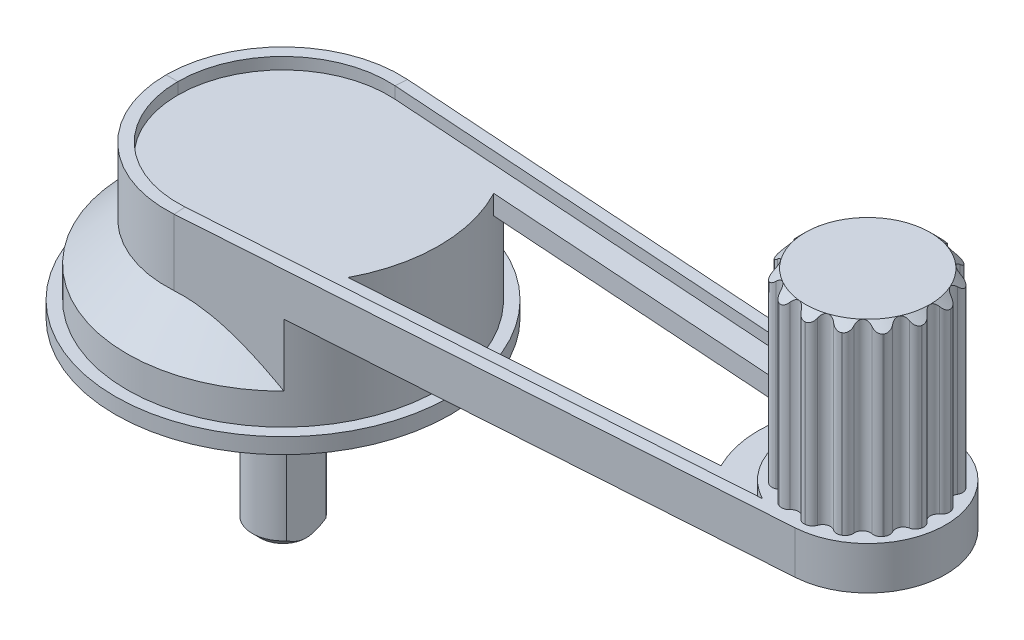
from build123d import *

# Parameters (mm, degrees)
EXTRUDE_START                    = -5
EXTRUDE_1_DEPTH                  = 12
SKETCH_5_R                       = 10
EXTRUDE_2_DEPTH                  = 5.5
EXTRUDE_3_DEPTH                  = 2.5
SKETCH_7_R                       = 9
EXTRUDE_4_DEPTH                  = 23.5
CHAMFER_1_SIZE                   = 1
SKETCH_8_R                       = 1
CUT_EXTRUDE_1_DEPTH              = 23.5
FILLET_1_R                       = 1
PATTERN_CIRCULAR_1_COUNT         = 15
FILLET_1_OF_PATTERN_CIRCULAR_1_R = 1
SKETCH_9_W                       = 3.915535099
SKETCH_9_H                       = 16.198515065
CUT_EXTRUDE_2_DEPTH              = 20


with BuildPart() as part:
    # 草图1 → 旋转1 (revolve)
    with BuildSketch(Plane.XY, mode=Mode.PRIVATE) as revolve_1_sk:
        Polygon((0, 0), (-3.925, 0), (-3.925, 20), (-11.5, 20), (-11.5, 23), (-21.5, 23), (-21.5, 25), (-20, 25), (-20, 29), (-15, 34), (0, 34), align=None)
    revolve(revolve_1_sk.sketch.rotate(Axis((0, 0, 0), (0, -1, 0)), 270), axis=Axis((0, 0, 0), (0, -1, 0)))



with BuildPart() as body_2:
    # 扫描1: sweep along a path in 草图3
    with BuildLine(Plane(origin=(0, 42.5, 0), x_dir=(1, 0, 0), z_dir=(0, 1, 0))) as sweep_1_path:
        Line((1, 14.966629547), (75.666666667, 9.977753031))
        ThreePointArc((75.666666667, 9.977753031), (85, 0), (75.666666667, -9.977753031))
        Line((75.666666667, -9.977753031), (1, -14.966629547))
        ThreePointArc((1, -14.966629547), (-15, 0), (1, 14.966629547))
    # 草图2 → 扫描1 (sweep)
    with BuildSketch(Plane.XY):
        Polygon((-15, 42.5), (-15, 37), (-13.5, 37), (-13.5, 38.5), (-10.5, 38.5), (-10.5, 41), (-13.5, 41), (-13.5, 42.5), align=None)
    sweep(path=sweep_1_path.line)


with BuildPart() as part_1:
    add(part.part)

    add(body_2.part)  # 凸台-拉伸1 merges body 2
    # 草图4 → 凸台-拉伸1 (add)
    with BuildSketch(Plane(origin=(0, 34, 0), x_dir=(1, 0, 0), z_dir=(0, 1, 0)).offset(EXTRUDE_START)):
        with BuildLine():
            Line((14.199326582, -14.084712443), (1, -14.966629547))
            ThreePointArc((1, -14.966629547), (-10.246950766, -10.95445115), (-15, 0))
            ThreePointArc((-15, 0), (-10.246950766, 10.95445115), (1, 14.966629547))
            Line((1, 14.966629547), (14.199326582, 14.084712443))
            ThreePointArc((14.199326582, 14.084712443), (20, 0), (14.199326582, -14.084712443))
        make_face()
    extrude(amount=EXTRUDE_1_DEPTH)

    # 草图5 → 凸台-拉伸2 (add)
    with BuildSketch(Plane.XZ.offset(-37)):
        with Locations((75, 0)):
            Circle(SKETCH_5_R)
    extrude(amount=-EXTRUDE_2_DEPTH)

    # 草图6 → 凸台-拉伸3 (add)
    with BuildSketch(Plane.XZ.offset(-38.5)):
        with BuildLine():
            Line((65.890505184, -10.630950296), (75.666666667, -9.977753031))
            ThreePointArc((75.666666667, -9.977753031), (65, 0), (75.666666667, 9.977753031))
            Line((75.666666667, 9.977753031), (65.890505184, 10.630950296))
            ThreePointArc((65.890505184, 10.630950296), (61, 0), (65.890505184, -10.630950296))
        make_face()
    extrude(amount=-EXTRUDE_3_DEPTH)

    # 草图7 → 凸台-拉伸4 (add)
    with BuildSketch(Plane(origin=(0, 42.5, 0), x_dir=(1, 0, 0), z_dir=(0, 1, 0))):
        with Locations(Location((75, 0, 0), (0, 0, 90))):
            Circle(SKETCH_7_R)
    extrude(amount=EXTRUDE_4_DEPTH)

    # 倒角1
    chamfer_1_edges = [part_1.edges().sort_by_distance(p)[0] for p in [
        (75, 66, 9),
    ]]
    chamfer(chamfer_1_edges, length=CHAMFER_1_SIZE)

    # 草图8 → 切除-拉伸1 (cut)
    with BuildSketch(Plane(origin=(0, 66, 0), x_dir=(1, 0, 0), z_dir=(0, 1, 0))):
        with Locations((84, 0)):
            Circle(SKETCH_8_R)
    cut_extrude_1 = extrude(amount=-CUT_EXTRUDE_1_DEPTH, mode=Mode.SUBTRACT)

    # 圆角1
    fillet_1_edges = [part_1.edges().sort_by_distance(p)[0] for p in [
        (83.944444444, 53.75, 0.998455598),
        (83.944444444, 53.75, -0.998455598),
    ]]
    fillet(fillet_1_edges, radius=FILLET_1_R)

    # 阵列(圆周)1: 切除-拉伸1 ×15 about axis
    pattern_circular_1_axis = Axis((75, 0, 0), (0, 1, 0))
    for i in range(1, PATTERN_CIRCULAR_1_COUNT):
        add(cut_extrude_1.rotate(pattern_circular_1_axis, i * 360 / PATTERN_CIRCULAR_1_COUNT), mode=Mode.SUBTRACT)

    # 圆角1 of 阵列(圆周)1
    fillet_1_of_pattern_circular_1_edges = [part_1.edges().sort_by_distance(p)[0] for p in [
        (83.577265071, 53.75, -2.725898732),
        (82.765048115, 53.75, -4.550167883),
        (81.726998645, 53.75, -5.978920406),
        (80.243004424, 53.75, -7.315114805),
        (78.713573041, 53.75, -8.198132426),
        (76.814397636, 53.75, -8.815211921),
        (75.058036921, 53.75, -8.999812871),
        (73.072065014, 53.75, -8.791078813),
        (71.39246569, 53.75, -8.24534391),
        (69.663089866, 53.75, -7.246888313),
        (68.350669915, 53.75, -6.065180081),
        (67.176914964, 53.75, -4.449644988),
        (66.458603718, 53.75, -2.836291515),
        (66.043422535, 53.75, -0.883017621),
        (66.043422535, 53.75, 0.883017621),
        (66.458603718, 53.75, 2.836291515),
        (67.176914964, 53.75, 4.449644988),
        (68.350669915, 53.75, 6.065180081),
        (69.663089866, 53.75, 7.246888313),
        (71.39246569, 53.75, 8.24534391),
        (73.072065014, 53.75, 8.791078813),
        (75.058036921, 53.75, 8.999812871),
        (76.814397636, 53.75, 8.815211921),
        (78.713573041, 53.75, 8.198132426),
        (80.243004424, 53.75, 7.315114805),
        (81.726998645, 53.75, 5.978920406),
        (82.765048115, 53.75, 4.550167883),
        (83.577265071, 53.75, 2.725898732),
    ]]
    fillet(fillet_1_of_pattern_circular_1_edges, radius=FILLET_1_OF_PATTERN_CIRCULAR_1_R)

    # 草图9 → 切除-拉伸2 (cut)
    with BuildSketch(Plane.XZ):
        with Locations((4.93276755, -0.214549868)):
            Rectangle(SKETCH_9_W, SKETCH_9_H)
    extrude(amount=-CUT_EXTRUDE_2_DEPTH, mode=Mode.SUBTRACT)

    # 倒角2: read off the stored shape, not the designer's step
    # 倒角2 outline → 倒角2 (revolve, cut)
    with BuildSketch(Plane.XY):
        Polygon((3.925, 0), (3.925, 1), (2.925, 0), align=None)
    revolve(axis=Axis((0, 0, 0), (0, 1, 0)), mode=Mode.SUBTRACT)

    # Chamfer 2 2 outline → Chamfer 2 2 (revolve)
    with BuildSketch(Plane.XY):
        Polygon((11.5, 23), (11.5, 22), (12.5, 23), align=None)
    revolve(axis=Axis((0, 0, 0), (0, 1, 0)))


solid = part_1.part
